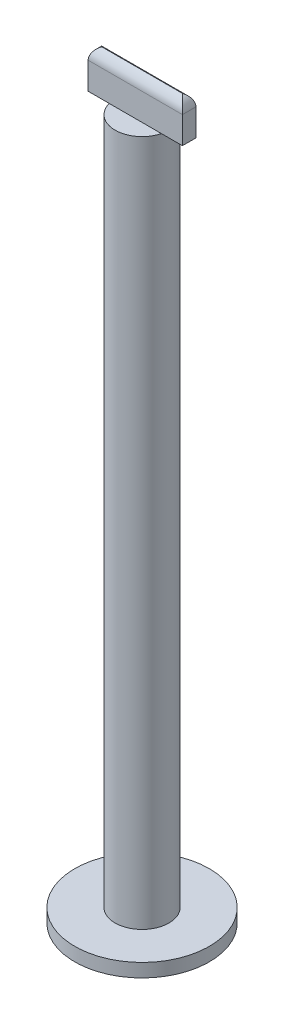
from build123d import *

# Parameters (mm, degrees)
SKETCH1_R           = 2
BOSS_EXTRUDE1_DEPTH = 52
SKETCH2_R           = 5
BOSS_EXTRUDE2_DEPTH = 1
SKETCH3_W           = 7
SKETCH3_H           = 1
BOSS_EXTRUDE3_DEPTH = 3
FILLET1_R           = 1


with BuildPart() as part:
    # Sketch1 → Boss-Extrude1 (new body)
    with BuildSketch(Plane(origin=(0, 0, 0), x_dir=(1, 0, 0), z_dir=(0, 1, 0))):
        with Locations(Location((0, 0, 0), (0, 0, 90))):
            Circle(SKETCH1_R)
    extrude(amount=BOSS_EXTRUDE1_DEPTH)

    # Sketch2 → Boss-Extrude2 (add)
    with BuildSketch(Plane.XZ):
        with Locations(Location((0, 0, 0), (0, 0, 270))):
            Circle(SKETCH2_R)
    extrude(amount=-BOSS_EXTRUDE2_DEPTH)

    # Sketch3 → Boss-Extrude3 (add)
    with BuildSketch(Plane(origin=(0, 52, 0), x_dir=(1, 0, 0), z_dir=(0, 1, 0))):
        Rectangle(SKETCH3_W, SKETCH3_H)
    extrude(amount=BOSS_EXTRUDE3_DEPTH)

    # Fillet1
    # the kernel refuses this fillet: 1 mm, written as the material it takes off along each edge
    with BuildSketch(Plane(origin=(3.5, 55, 3), x_dir=(0, -1, 0), z_dir=(0, 0, -1)), Plane(origin=(-3.5, 55, -3), x_dir=(0, -1, 0), z_dir=(0, 0, 1))) as fillet1_piece_1:
        with BuildLine():
            CenterArc((FILLET1_R, FILLET1_R), FILLET1_R, 180, 90)
            Line((0, FILLET1_R), (0, 0))
            Line((0, 0), (FILLET1_R, 0))
        make_face()
    extrude(amount=6, mode=Mode.SUBTRACT)
    with BuildSketch(Plane(origin=(6, 55, -0.5), x_dir=(0, -1, 0), z_dir=(-1, 0, 0)), Plane(origin=(-6, 55, 0.5), x_dir=(0, -1, 0), z_dir=(1, 0, 0))) as fillet1_piece_2:
        with BuildLine():
            CenterArc((FILLET1_R, FILLET1_R), FILLET1_R, 180, 90)
            Line((0, FILLET1_R), (0, 0))
            Line((0, 0), (FILLET1_R, 0))
        make_face()
    extrude(amount=12, mode=Mode.SUBTRACT)


solid = part.part
